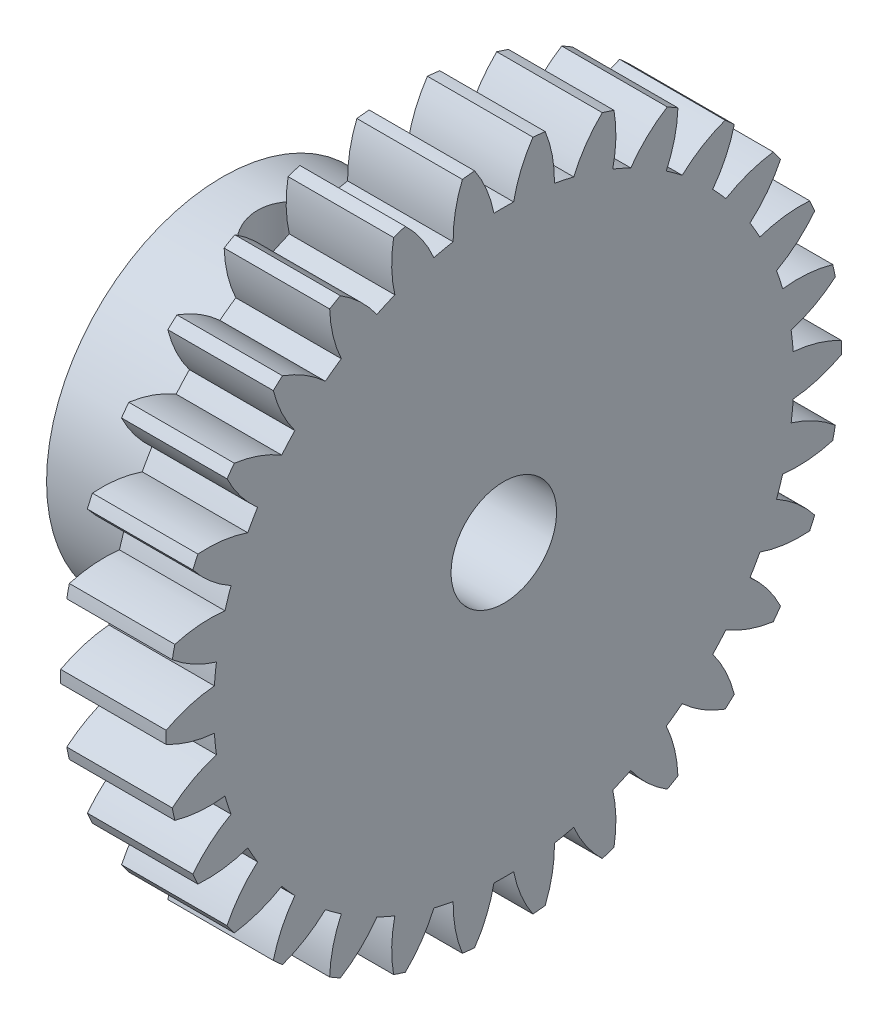
from build123d import *

# Parameters (mm, degrees)
BASPROSKE_W                = 3
BASPROSKE_H                = 9.6
TOOTHCUT_DEPTH             = 14.903956272
TEETHCUTS_COUNT            = 30
TEETHCUTS_ANGLE            = 348
HUBNEAONESKE_R             = 5
HUBNEARONE_DEPTH           = 5.0000508
BORSKE_R                   = 1.5
BORE_DEPTH                 = 8.0000508
HOLE_WIZARD_M3_1_OUTLINE_W = 1.25
HOLE_WIZARD_M3_1_OUTLINE_H = 5.000059641


# Read off the part's stored shape, not the designer's step: M3 螺纹孔1
with BuildPart() as part:
    # BasProSke → Base-Revolve (revolve)
    with BuildSketch(Plane(origin=(0, 0, 0), x_dir=(1, 0, 0), z_dir=(0, 1, 0)), mode=Mode.PRIVATE) as base_revolve_sk:
        with Locations((1.5, 4.8)):
            Rectangle(BASPROSKE_W, BASPROSKE_H)
    revolve(base_revolve_sk.sketch.rotate(Axis((-10, 0, 0), (1, 0, 0)), 180), axis=Axis((-10, 0, 0), (1, 0, 0)))

    # TooCutSke → ToothCut (cut, through all)
    with BuildSketch(Plane(origin=(0, 0, 0), x_dir=(0, 0, -1), z_dir=(1, 0, 0))):
        with BuildLine():
            ThreePointArc((0.280083172, 8.244243714), (0, 8.249), (-0.280083172, 8.244243714))
            ThreePointArc((-0.280083172, 8.244243714), (-0.494011324, 8.945142616), (-0.845441941, 9.588198636))
            ThreePointArc((-0.845441941, 9.588198636), (0, 9.6254), (0.845441941, 9.588198636))
            ThreePointArc((0.845441941, 9.588198636), (0.494011324, 8.945142616), (0.280083172, 8.244243714))
        make_face()
    toothcut = extrude(amount=TOOTHCUT_DEPTH, mode=Mode.SUBTRACT)

    # TeethCuts: ToothCut ×30 about axis
    teethcuts_axis = Axis((-10, 0, 0), (1, 0, 0))
    for i in range(1, TEETHCUTS_COUNT):
        add(toothcut.rotate(teethcuts_axis, i * TEETHCUTS_ANGLE / (TEETHCUTS_COUNT - 1)), mode=Mode.SUBTRACT)

    # HubNeaOneSke → HubNearOne (add)
    with BuildSketch(Plane.ZY):
        with Locations(Location((0, 0, 0), (0, 0, 180))):
            Circle(HUBNEAONESKE_R)
    extrude(amount=HUBNEARONE_DEPTH)

    # BorSke → Bore (cut, symmetric)
    with BuildSketch(Plane(origin=(0, 0, 0), x_dir=(0, 0, -1), z_dir=(1, 0, 0))):
        with Locations(Location((0, 0, 0), (0, 0, 180))):
            Circle(BORSKE_R)
    extrude(amount=BORE_DEPTH, both=True, mode=Mode.SUBTRACT)

    # M3 螺纹孔1 outline → M3 螺纹孔1 (revolve, cut)
    with BuildSketch(Plane(origin=(-2.442766252, 0, 0.384163005), x_dir=(1, 0, 0), z_dir=(0, 0, 1))):
        with Locations((0.625, 2.50002982)):
            Rectangle(HOLE_WIZARD_M3_1_OUTLINE_W, HOLE_WIZARD_M3_1_OUTLINE_H)
    revolve(axis=Axis((-2.442766252, 0, 0.384163005), (0, 1, 0)), mode=Mode.SUBTRACT)


solid = part.part
